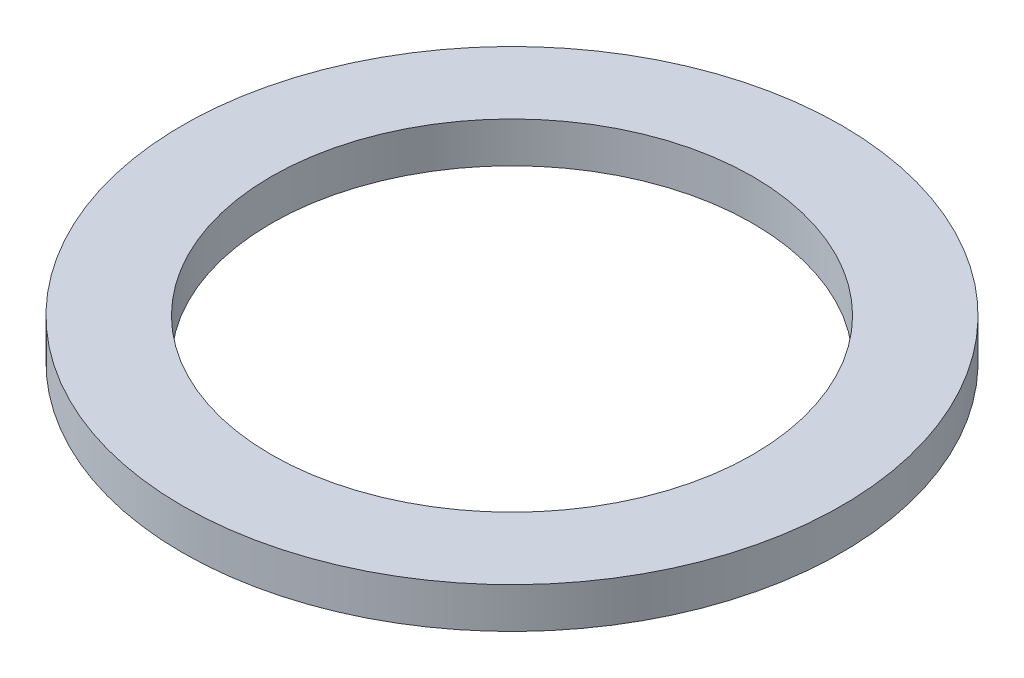
from build123d import *

# Parameters (mm, degrees)
SKETCH1_R           = 65
BOSS_EXTRUDE1_DEPTH = 8
SKETCH2_R           = 47.5
CUT_EXTRUDE1_DEPTH  = 93.271338995


with BuildPart() as part:
    # Sketch1 → Boss-Extrude1 (new body)
    with BuildSketch(Plane(origin=(0, 0, 0), x_dir=(1, 0, 0), z_dir=(0, 1, 0))):
        Circle(SKETCH1_R)
    extrude(amount=BOSS_EXTRUDE1_DEPTH)

    # Sketch2 → Cut-Extrude1 (cut, through all)
    with BuildSketch(Plane(origin=(0, 0, 0), x_dir=(1, 0, 0), z_dir=(0, 1, 0))):
        Circle(SKETCH2_R)
    extrude(amount=CUT_EXTRUDE1_DEPTH, mode=Mode.SUBTRACT)


solid = part.part
